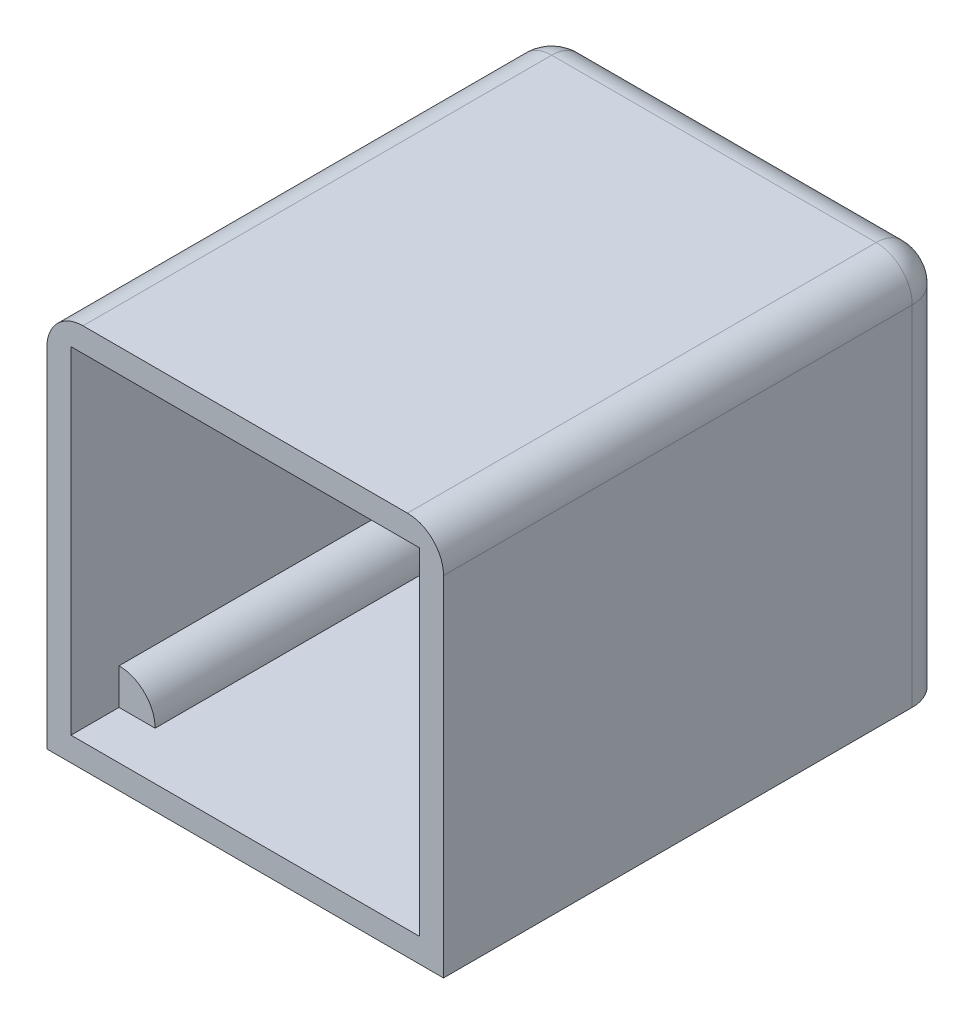
from build123d import *

# Parameters (mm, degrees)
SKETCH_1_W      = 33
SKETCH_1_H      = 32
SKETCH_1_W_2    = 29
SKETCH_1_H_2    = 28
EXTRUDE_1_DEPTH = 40
SKETCH_2_W      = 33
SKETCH_2_H      = 32
SKETCH_2_W_2    = 10
SKETCH_2_H_2    = 3
EXTRUDE_2_DEPTH = 2
EXTRUDE_3_DEPTH = 36
FILLET_1_R      = 3
FILLET_2_R      = 3
FILLET_3_R      = 3


with BuildPart() as part:
    # 草图1 → 凸台-拉伸1 (new body)
    with BuildSketch(Plane.XY):
        with Locations((0.442802767, -3.343094476)):
            Rectangle(SKETCH_1_W, SKETCH_1_H)
        with Locations((0.442802767, -3.343094476)):
            Rectangle(SKETCH_1_W_2, SKETCH_1_H_2, mode=Mode.SUBTRACT)
    extrude(amount=EXTRUDE_1_DEPTH)

    # 草图2 → 凸台-拉伸2 (add)
    with BuildSketch(Plane(origin=(0, 0, 0), x_dir=(-1, 0, 0), z_dir=(0, 0, -1))):
        with Locations((-0.442802767, -3.343094476)):
            Rectangle(SKETCH_2_W, SKETCH_2_H)
        with Locations((-0.442802767, -11.661758268)):
            Rectangle(SKETCH_2_W_2, SKETCH_2_H_2, mode=Mode.SUBTRACT)
    extrude(amount=EXTRUDE_2_DEPTH)

    # 草图5 → 凸台-拉伸3 (add)
    with BuildSketch(Plane(origin=(0, 0, 0), x_dir=(-1, 0, 0), z_dir=(0, 0, -1))):
        with BuildLine():
            Line((11.057197233, 10.656905524), (14.057197233, 10.656905524))
            Line((14.057197233, 10.656905524), (14.057197233, 7.656905524))
            ThreePointArc((14.057197233, 7.656905524), (11.935876889, 8.535585181), (11.057197233, 10.656905524))
        make_face()
        with BuildLine():
            Line((-11.942802767, 10.656905524), (-14.942802767, 10.656905524))
            Line((-14.942802767, 10.656905524), (-14.942802767, 7.656905524))
            ThreePointArc((-14.942802767, 7.656905524), (-12.821482424, 8.535585181), (-11.942802767, 10.656905524))
        make_face()
        with BuildLine():
            Line((-14.942802767, -14.343094476), (-14.942802767, -17.343094476))
            Line((-14.942802767, -17.343094476), (-11.942802767, -17.343094476))
            ThreePointArc((-11.942802767, -17.343094476), (-12.821482424, -15.221774132), (-14.942802767, -14.343094476))
        make_face()
        with BuildLine():
            Line((11.057197233, -17.343094476), (14.057197233, -17.343094476))
            Line((14.057197233, -17.343094476), (14.057197233, -14.343094476))
            ThreePointArc((14.057197233, -14.343094476), (11.935876889, -15.221774132), (11.057197233, -17.343094476))
        make_face()
    extrude(amount=-EXTRUDE_3_DEPTH)

    # 圆角1
    fillet_1_edges = [part.edges().sort_by_distance(p)[0] for p in [
        (0.442802767, 12.656905524, -2),
        (16.942802767, 12.656905524, 19),
        (-16.057197233, 12.656905524, 19),
    ]]
    fillet(fillet_1_edges, radius=FILLET_1_R)

    # 圆角2
    # the kernel refuses this fillet: 3 mm, written as the material it takes off along each edge
    with BuildSketch(Plane(origin=(13.942802767, 9.656905524, 1), x_dir=(1, 0, 0), z_dir=(0, 0, -1))) as fillet_2_piece_1_section:
        Polygon((0, 0), (FILLET_2_R, 0), (FILLET_2_R, -FILLET_2_R), (0, -FILLET_2_R), align=None)
    fillet_2_piece_1 = extrude(amount=FILLET_2_R, mode=Mode.PRIVATE)
    fillet_2_piece_1 = fillet_2_piece_1 - Plane(origin=(13.942802767, 9.656905524, 1), x_dir=(-0.7071067811865475, -0.7071067811865475, 0), z_dir=(0, 0, -1)) * Sphere(FILLET_2_R, mode=Mode.PRIVATE)
    add(fillet_2_piece_1, mode=Mode.SUBTRACT)
    with BuildSketch(Plane(origin=(16.942802767, -26.843094476, -2), x_dir=(-1, 0, 0), z_dir=(0, 1, 0))) as fillet_2_piece_2:
        with BuildLine():
            CenterArc((FILLET_2_R, FILLET_2_R), FILLET_2_R, 180, 90)
            Line((0, FILLET_2_R), (0, 0))
            Line((0, 0), (FILLET_2_R, 0))
        make_face()
    extrude(amount=36.5, mode=Mode.SUBTRACT)

    # 圆角3
    # the kernel refuses this fillet: 3 mm, written as the material it takes off along each edge
    with BuildSketch(Plane(origin=(-13.057197233, 9.656905524, 1), x_dir=(0, 0, -1), z_dir=(-1, 0, 0))) as fillet_3_piece_1_section:
        Polygon((0, 0), (FILLET_3_R, 0), (FILLET_3_R, -FILLET_3_R), (0, -FILLET_3_R), align=None)
    fillet_3_piece_1 = extrude(amount=FILLET_3_R, mode=Mode.PRIVATE)
    fillet_3_piece_1 = fillet_3_piece_1 - Plane(origin=(-13.057197233, 9.656905524, 1), x_dir=(0, -0.7071067811865475, 0.7071067811865475), z_dir=(-1, 0, 0)) * Sphere(FILLET_3_R, mode=Mode.PRIVATE)
    add(fillet_3_piece_1, mode=Mode.SUBTRACT)
    with BuildSketch(Plane(origin=(-16.057197233, 9.656905524, -2), x_dir=(0, 0, 1), z_dir=(0, -1, 0))) as fillet_3_piece_2:
        with BuildLine():
            CenterArc((FILLET_3_R, -FILLET_3_R), FILLET_3_R, 90, 90)
            Line((0, -FILLET_3_R), (0, 0))
            Line((0, 0), (FILLET_3_R, 0))
        make_face()
    extrude(amount=36.5, mode=Mode.SUBTRACT)


solid = part.part
